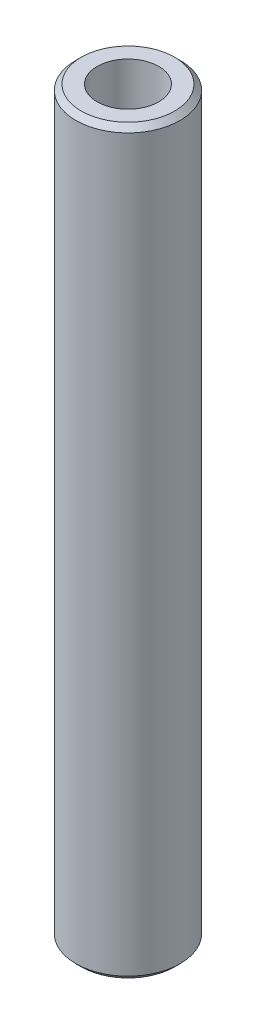
from build123d import *

# Parameters (mm, degrees)
SKETCH1_R           = 17.5
BOSS_EXTRUDE1_DEPTH = 248.843222344
SKETCH2_R           = 10.331876847
CUT_EXTRUDE1_DEPTH  = 251.070888562
CHAMFER1_SIZE       = 1.821961499


with BuildPart() as part:
    # Sketch1 → Boss-Extrude1 (new body)
    with BuildSketch(Plane(origin=(0, 0, 0), x_dir=(1, 0, 0), z_dir=(0, 1, 0))):
        Circle(SKETCH1_R)
    extrude(amount=BOSS_EXTRUDE1_DEPTH)

    # Sketch2 → Cut-Extrude1 (cut, through all)
    with BuildSketch(Plane(origin=(0, 0, 0), x_dir=(1, 0, 0), z_dir=(0, 1, 0))):
        Circle(SKETCH2_R)
    extrude(amount=CUT_EXTRUDE1_DEPTH, mode=Mode.SUBTRACT)

    # Chamfer1
    chamfer1_edges = [part.edges().sort_by_distance(p)[0] for p in [
        (-17.5, 248.843222344, 0),
        (-17.5, 0, 0),
    ]]
    chamfer(chamfer1_edges, length=CHAMFER1_SIZE)


solid = part.part
